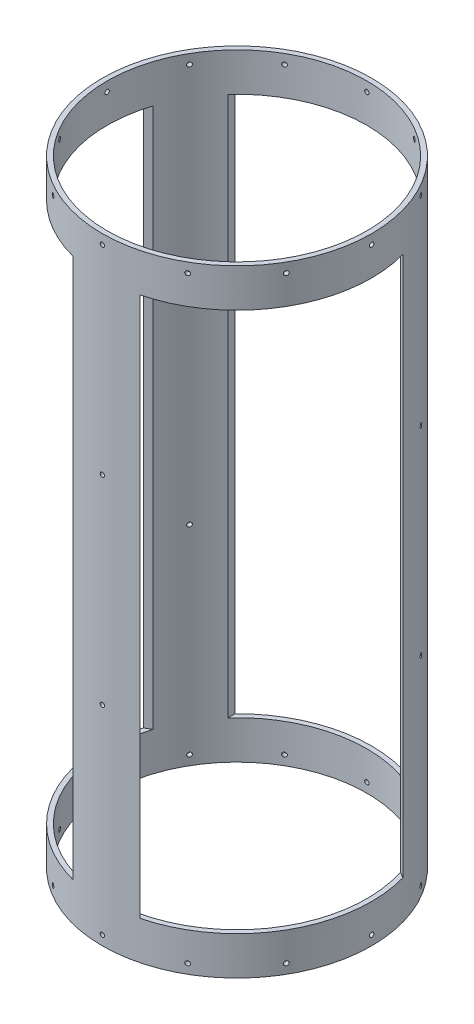
from build123d import *

# Parameters (mm, degrees)
SKETCH1_R                = 88.9
SKETCH1_R_2              = 85.725
BOSS_EXTRUDE1_DEPTH      = 203.581
CUT_EXTRUDE1_REACH       = 241.273
CUT_EXTRUDE1_END_RADIUS  = 88.9
SKETCH2_W                = 127
SKETCH2_H                = 356.362
CIRPATTERN1_COUNT        = 3
SKETCH4_R                = 1.4351
CUT_EXTRUDE3_DEPTH       = 15.24
CIRPATTERN3_COUNT        = 12
MIRROR1_COPY_1_SKETCH_R  = 1.4351
MIRROR1_COPY_1_DEPTH     = 15.24
MIRROR1_COPY_2_SKETCH_R  = 1.4351
MIRROR1_COPY_2_DEPTH     = 15.24
MIRROR1_COPY_3_SKETCH_R  = 1.4351
MIRROR1_COPY_3_DEPTH     = 15.24
MIRROR1_COPY_4_SKETCH_R  = 1.4351
MIRROR1_COPY_4_DEPTH     = 15.24
MIRROR1_COPY_5_SKETCH_R  = 1.4351
MIRROR1_COPY_5_DEPTH     = 15.24
MIRROR1_COPY_6_SKETCH_R  = 1.4351
MIRROR1_COPY_6_DEPTH     = 15.24
MIRROR1_COPY_7_SKETCH_R  = 1.4351
MIRROR1_COPY_7_DEPTH     = 15.24
MIRROR1_COPY_8_SKETCH_R  = 1.4351
MIRROR1_COPY_8_DEPTH     = 15.24
MIRROR1_COPY_9_SKETCH_R  = 1.4351
MIRROR1_COPY_9_DEPTH     = 15.24
MIRROR1_COPY_10_SKETCH_R = 1.4351
MIRROR1_COPY_10_DEPTH    = 15.24
MIRROR1_COPY_11_SKETCH_R = 1.4351
MIRROR1_COPY_11_DEPTH    = 15.24
SKETCH5_R                = 1.4351
CUT_EXTRUDE4_DEPTH       = 46.482
CIRPATTERN4_COUNT        = 3


with BuildPart() as part:
    # Sketch1 → Boss-Extrude1 (new, symmetric)
    with BuildSketch(Plane(origin=(0, 0, 0), x_dir=(1, 0, 0), z_dir=(0, 1, 0))):
        Circle(SKETCH1_R)
        Circle(SKETCH1_R_2, mode=Mode.SUBTRACT)
    extrude(amount=BOSS_EXTRUDE1_DEPTH, both=True)

    # Cut-Extrude1: up to this cylinder (the profile starts inside it)
    cut_extrude1_end = Plane(origin=(0, 0, 0), z_dir=(0, -1, 0)) * Cylinder(CUT_EXTRUDE1_END_RADIUS, 661.346, mode=Mode.PRIVATE)
    # Sketch2 → Cut-Extrude1 (cut, up to the surface)
    with BuildSketch(Plane.XY, mode=Mode.PRIVATE) as cut_extrude1_sk1:
        Rectangle(SKETCH2_W, SKETCH2_H)
    cut_extrude1_tool1 = extrude(cut_extrude1_sk1.sketch, amount=-CUT_EXTRUDE1_REACH, mode=Mode.PRIVATE) & cut_extrude1_end
    cut_extrude1 = cut_extrude1_tool1.solids().sort_by_distance((0, 0, 0))[0]
    add(cut_extrude1, mode=Mode.SUBTRACT)

    # CirPattern1: Cut-Extrude1 ×3 about axis
    cirpattern1_axis = Axis((0, 203.581, 0), (0, -1, 0))
    for i in range(1, CIRPATTERN1_COUNT):
        add(cut_extrude1.rotate(cirpattern1_axis, i * 360 / CIRPATTERN1_COUNT), mode=Mode.SUBTRACT)

    # Sketch4 → Cut-Extrude3 (cut)
    with BuildSketch(Plane(origin=(88.9, 0, 0), x_dir=(0, 0, -1), z_dir=(1, 0, 0))):
        with Locations((0, 197.231)):
            Circle(SKETCH4_R)
    cut_extrude3 = extrude(amount=-CUT_EXTRUDE3_DEPTH, mode=Mode.SUBTRACT)

    # CirPattern3: Cut-Extrude3 ×12 about axis
    cirpattern3_axis = Axis((0, 203.581, 0), (0, -1, 0))
    for i in range(1, CIRPATTERN3_COUNT):
        add(cut_extrude3.rotate(cirpattern3_axis, i * 360 / CIRPATTERN3_COUNT), mode=Mode.SUBTRACT)

    # Mirror1: Cut-Extrude3 across plane
    add(cut_extrude3.mirror(Plane.ZX), mode=Mode.SUBTRACT)

    # Mirror1 copy 1 sketch → Mirror1 copy 1 (cut)
    with BuildSketch(Plane(origin=(76.989658396, 0, 44.45), x_dir=(0.49999999999999994, 0, -0.8660254037844387), z_dir=(0.8660254037844387, 0, 0.49999999999999994))):
        with Locations((0, -197.231)):
            Circle(MIRROR1_COPY_1_SKETCH_R)
    extrude(amount=-MIRROR1_COPY_1_DEPTH, mode=Mode.SUBTRACT)

    # Mirror1 copy 2 sketch → Mirror1 copy 2 (cut)
    with BuildSketch(Plane(origin=(44.45, 0, 76.989658396), x_dir=(0.8660254037844386, 0, -0.5000000000000001), z_dir=(0.5000000000000001, 0, 0.8660254037844386))):
        with Locations((0, -197.231)):
            Circle(MIRROR1_COPY_2_SKETCH_R)
    extrude(amount=-MIRROR1_COPY_2_DEPTH, mode=Mode.SUBTRACT)

    # Mirror1 copy 3 sketch → Mirror1 copy 3 (cut)
    with BuildSketch(Plane.XY.offset(88.9)):
        with Locations((0, -197.231)):
            Circle(MIRROR1_COPY_3_SKETCH_R)
    extrude(amount=-MIRROR1_COPY_3_DEPTH, mode=Mode.SUBTRACT)

    # Mirror1 copy 4 sketch → Mirror1 copy 4 (cut)
    with BuildSketch(Plane(origin=(-44.45, 0, 76.989658396), x_dir=(0.8660254037844387, 0, 0.4999999999999998), z_dir=(-0.4999999999999998, 0, 0.8660254037844387))):
        with Locations((0, -197.231)):
            Circle(MIRROR1_COPY_4_SKETCH_R)
    extrude(amount=-MIRROR1_COPY_4_DEPTH, mode=Mode.SUBTRACT)

    # Mirror1 copy 5 sketch → Mirror1 copy 5 (cut)
    with BuildSketch(Plane(origin=(-76.989658396, 0, 44.45), x_dir=(0.49999999999999994, 0, 0.8660254037844387), z_dir=(-0.8660254037844387, 0, 0.49999999999999994))):
        with Locations((0, -197.231)):
            Circle(MIRROR1_COPY_5_SKETCH_R)
    extrude(amount=-MIRROR1_COPY_5_DEPTH, mode=Mode.SUBTRACT)

    # Mirror1 copy 6 sketch → Mirror1 copy 6 (cut)
    with BuildSketch(Plane.ZY.offset(88.9)):
        with Locations((0, -197.231)):
            Circle(MIRROR1_COPY_6_SKETCH_R)
    extrude(amount=-MIRROR1_COPY_6_DEPTH, mode=Mode.SUBTRACT)

    # Mirror1 copy 7 sketch → Mirror1 copy 7 (cut)
    with BuildSketch(Plane(origin=(-76.989658396, 0, -44.45), x_dir=(-0.5000000000000001, 0, 0.8660254037844386), z_dir=(-0.8660254037844386, 0, -0.5000000000000001))):
        with Locations((0, -197.231)):
            Circle(MIRROR1_COPY_7_SKETCH_R)
    extrude(amount=-MIRROR1_COPY_7_DEPTH, mode=Mode.SUBTRACT)

    # Mirror1 copy 8 sketch → Mirror1 copy 8 (cut)
    with BuildSketch(Plane(origin=(-44.45, 0, -76.989658396), x_dir=(-0.8660254037844384, 0, 0.5000000000000004), z_dir=(-0.5000000000000004, 0, -0.8660254037844384))):
        with Locations((0, -197.231)):
            Circle(MIRROR1_COPY_8_SKETCH_R)
    extrude(amount=-MIRROR1_COPY_8_DEPTH, mode=Mode.SUBTRACT)

    # Mirror1 copy 9 sketch → Mirror1 copy 9 (cut)
    with BuildSketch(Plane(origin=(0, 0, -88.9), x_dir=(-1, 0, 0), z_dir=(0, 0, -1))):
        with Locations((0, -197.231)):
            Circle(MIRROR1_COPY_9_SKETCH_R)
    extrude(amount=-MIRROR1_COPY_9_DEPTH, mode=Mode.SUBTRACT)

    # Mirror1 copy 10 sketch → Mirror1 copy 10 (cut)
    with BuildSketch(Plane(origin=(44.45, 0, -76.989658396), x_dir=(-0.8660254037844386, 0, -0.5000000000000001), z_dir=(0.5000000000000001, 0, -0.8660254037844386))):
        with Locations((0, -197.231)):
            Circle(MIRROR1_COPY_10_SKETCH_R)
    extrude(amount=-MIRROR1_COPY_10_DEPTH, mode=Mode.SUBTRACT)

    # Mirror1 copy 11 sketch → Mirror1 copy 11 (cut)
    with BuildSketch(Plane(origin=(76.989658396, 0, -44.45), x_dir=(-0.5000000000000004, 0, -0.8660254037844384), z_dir=(0.8660254037844384, 0, -0.5000000000000004))):
        with Locations((0, -197.231)):
            Circle(MIRROR1_COPY_11_SKETCH_R)
    extrude(amount=-MIRROR1_COPY_11_DEPTH, mode=Mode.SUBTRACT)

    # Sketch5 → Cut-Extrude4 (cut)
    with BuildSketch(Plane.XY.offset(88.9)):
        with Locations((0, -65.7606)):
            Circle(SKETCH5_R)
        with Locations((0, 65.7606)):
            Circle(SKETCH5_R)
    cut_extrude4 = extrude(amount=-CUT_EXTRUDE4_DEPTH, mode=Mode.SUBTRACT)

    # CirPattern4: Cut-Extrude4 ×3 about axis
    cirpattern4_axis = Axis((0, 203.581, 0), (0, -1, 0))
    for i in range(1, CIRPATTERN4_COUNT):
        add(cut_extrude4.rotate(cirpattern4_axis, i * 360 / CIRPATTERN4_COUNT), mode=Mode.SUBTRACT)


solid = part.part
